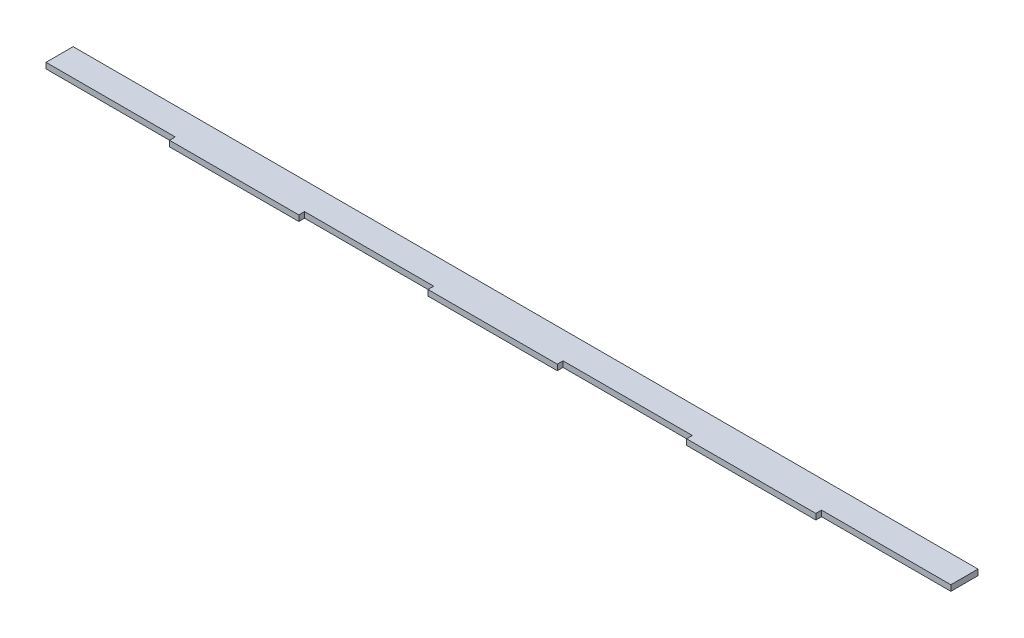
from build123d import *

# Parameters (mm, degrees)
BOSS_EXTRUDE1_DEPTH = 3.175


with BuildPart() as part:
    # Sketch1 → Boss-Extrude1 (new body)
    with BuildSketch(Plane(origin=(0, 0, 0), x_dir=(1, 0, 0), z_dir=(0, 1, 0))):
        Polygon((-21.442857143, 0), (-21.442857143, 15), (478.557142857, 15), (478.557142857, 0), (407.128571429, 0), (407.128571429, -3.175), (335.7, -3.175), (335.7, 0), (264.271428571, 0), (264.271428571, -3.175), (192.842857143, -3.175), (192.842857143, 0), (121.414285714, 0), (121.414285714, -3.175), (49.985714286, -3.175), (49.985714286, 0), align=None)
    extrude(amount=BOSS_EXTRUDE1_DEPTH)


solid = part.part
